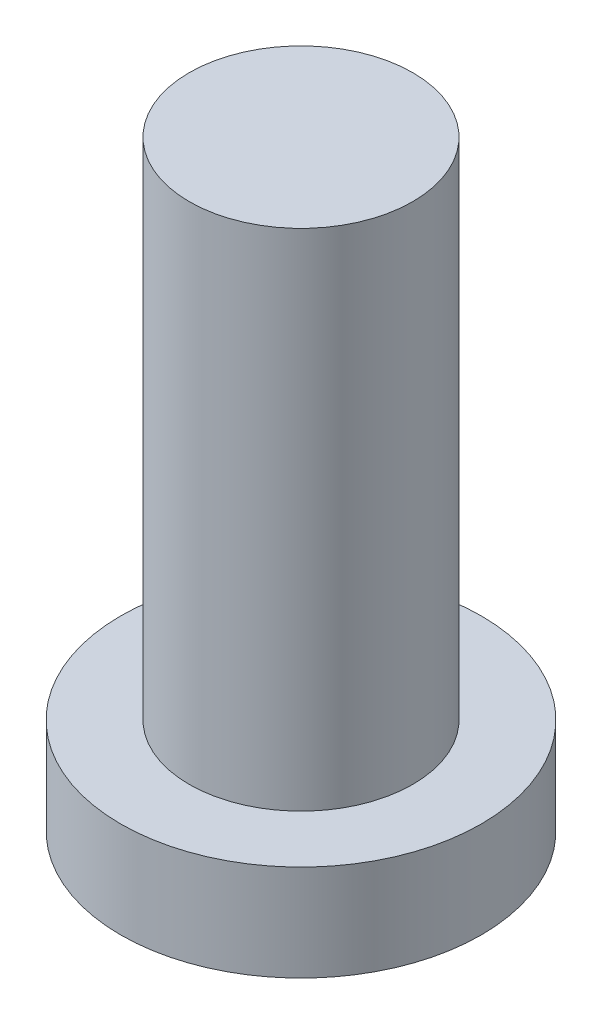
from build123d import *

# Parameters (mm, degrees)
SKETCH1_R           = 7.5
BOSS_EXTRUDE3_DEPTH = 4
SKETCH4_R           = 4.65
BOSS_EXTRUDE4_DEPTH = 21


with BuildPart() as part:
    # Sketch1 → Boss-Extrude3 (new body)
    with BuildSketch(Plane(origin=(0, 0, 0), x_dir=(1, 0, 0), z_dir=(0, 1, 0))):
        Circle(SKETCH1_R)
    extrude(amount=BOSS_EXTRUDE3_DEPTH)

    # Sketch4 → Boss-Extrude4 (add)
    with BuildSketch(Plane(origin=(0, 4, 0), x_dir=(1, 0, 0), z_dir=(0, 1, 0))):
        Circle(SKETCH4_R)
    extrude(amount=BOSS_EXTRUDE4_DEPTH)


solid = part.part
